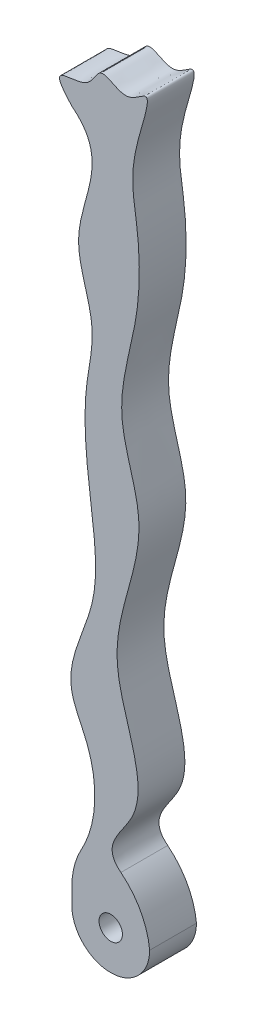
from build123d import *

# Parameters (mm, degrees)
SKETCH1_R           = 1.5
BOSS_EXTRUDE1_DEPTH = 6
SKETCH3_W           = 6
SKETCH3_H           = 19.728320027
SKETCH3_H_2         = 60.271679973
BOSS_EXTRUDE2_DEPTH = 10
SKETCH4_W           = 9.051057065
SKETCH4_H           = 6
CUT_EXTRUDE1_DEPTH  = 162
SKETCH5_W           = 2.776805371
SKETCH5_H           = 7.673994378
CUT_EXTRUDE2_DEPTH  = 162
SKETCH6_W           = 9.98
SKETCH6_H           = 6
BOSS_EXTRUDE3_DEPTH = 10
BOSS_EXTRUDE4_DEPTH = 6
CUT_EXTRUDE4_DEPTH  = 6
CUT_EXTRUDE5_DEPTH  = 6
FILLET1_START       = -1
FILLET1_DEPTH       = 8


with BuildPart() as part:
    # Sketch1 → Boss-Extrude1 (new body)
    with BuildSketch(Plane.XY):
        with BuildLine():
            Line((0, 0), (0, -9.98))
            Line((0, -9.98), (9.98, -9.98))
            Line((9.98, -9.98), (9.98, 0))
            add(Edge.make_bspline(
                [(0, 54.250736404), (-1.3001908, 57.732186027), (3.264697289, 54.364229546), (2.426320397, 59.671317952), (6.24965715, 57.931332096), (7.559999273, 60.308317398), (10.808963849, 60.427698471), (10.337139395, 56.901907174), (8.667893464, 54.394927102), (7.624843251, 50.040394793), (9.267984866, 44.554889548), (7.046090887, 37.973638675), (9.84685356, 30.217018819), (6.270285073, 21.673277978), (10.793667439, 11.106885954), (4.474903421, 3.416500301), (9.98, 0)],
                knots=[0, 0, 0, 0, 0.053422047, 0.084053188, 0.123826292, 0.153487584, 0.181182143, 0.220513, 0.254555574, 0.310198036, 0.38825613, 0.476667751, 0.573339812, 0.700293064, 0.81918735, 1, 1, 1, 1], degree=3))
            add(Edge.make_bspline(
                [(0, 54.250736404), (5.084395927, 51.698919308), (-1.040481835, 45.991903649), (5.447322124, 39.887247803), (0.909066537, 34.169036482), (6.005419265, 27.503354662), (0.487031558, 20.054851145), (5.671743487, 12.84454135), (0.403542473, 6.211235786), (5.177057559, 1.35031129), (0, 0)],
                knots=[0, 0, 0, 0, 0.175024795, 0.269809775, 0.365352016, 0.476782251, 0.63395402, 0.755982767, 0.862891176, 1, 1, 1, 1], degree=3))
        make_face()
        with Locations((4.99, -4.99)):
            Circle(SKETCH1_R, mode=Mode.SUBTRACT)
    extrude(amount=BOSS_EXTRUDE1_DEPTH)

    # Sketch3 → Boss-Extrude2 (add)
    with BuildSketch(Plane.ZY):
        with Locations((3, 70.135839987)):
            Rectangle(SKETCH3_W, SKETCH3_H)
        with Locations((3, 30.135839987)):
            Rectangle(SKETCH3_W, SKETCH3_H_2)
    extrude(amount=-BOSS_EXTRUDE2_DEPTH)

    # Sketch4 → Cut-Extrude1 (cut)
    with BuildSketch(Plane.XZ):
        with Locations((14.505528533, 3)):
            Rectangle(SKETCH4_W, SKETCH4_H)
    extrude(amount=-CUT_EXTRUDE1_DEPTH, mode=Mode.SUBTRACT)

    # Sketch5 → Cut-Extrude2 (cut)
    with BuildSketch(Plane.XZ.offset(9.98)):
        with Locations((-1.388402686, 2.163002811)):
            Rectangle(SKETCH5_W, SKETCH5_H)
    extrude(amount=-CUT_EXTRUDE2_DEPTH, mode=Mode.SUBTRACT)

    # Sketch6 → Boss-Extrude3 (add)
    with BuildSketch(Plane(origin=(0, 80, 0), x_dir=(1, 0, 0), z_dir=(0, 1, 0))):
        with Locations((4.99, -3)):
            Rectangle(SKETCH6_W, SKETCH6_H)
    extrude(amount=BOSS_EXTRUDE3_DEPTH)

    # Sketch7 → Boss-Extrude4 (add)
    with BuildSketch(Plane.XY.offset(6)):
        with BuildLine():
            Line((0, 0), (9.98, 0))
            add(Edge.make_bspline(
                [(0, 83.724231828), (-3.860120501, 87.893159061), (1.875984915, 85.269985621), (3.67621996, 90.493946858), (6.74031748, 87.256477942), (10.910791453, 91.330502674), (6.94132405, 80.93059981), (8.63400219, 74.989003981), (8.904822247, 63.614217887), (4.761347691, 53.094578021), (11.070596211, 39.679531964), (2.06869458, 25.535490062), (12.628458408, 9.599332358), (1.827356394, 2.776036691), (9.98, 0)],
                knots=[0, 0, 0, 0, 0.06130885, 0.083016766, 0.115331592, 0.138604375, 0.192961713, 0.27875924, 0.366903135, 0.489663243, 0.583584237, 0.749388452, 0.899317268, 1, 1, 1, 1], degree=3))
            add(Edge.make_bspline(
                [(0, 83.724231828), (5.303604513, 79.627551199), (-1.724082843, 71.171061089), (3.506871724, 61.210633208), (1.012601117, 51.32037438), (2.484565744, 41.12836032), (3.801376789, 29.33837591), (-1.788318883, 20.592225029), (3.990043149, 11.280963243), (3.127348918, 3.88723838), (0, 0)],
                knots=[0, 0, 0, 0, 0.178407716, 0.282250633, 0.360012872, 0.523096627, 0.638532862, 0.770288181, 0.82976307, 1, 1, 1, 1], degree=3))
        make_face()
    extrude(amount=-BOSS_EXTRUDE4_DEPTH)

    # Sketch8 → Cut-Extrude4 (cut)
    with BuildSketch(Plane.XY):
        with BuildLine():
            Line((-20.353011205, 0), (0, 0))
            add(Edge.make_bspline(
                [(0, 83.724231828), (5.303604513, 79.627551199), (-1.724082843, 71.171061089), (3.506871724, 61.210633208), (1.012601117, 51.32037438), (2.484565744, 41.12836032), (3.801376789, 29.33837591), (-1.788318883, 20.592225029), (3.990043149, 11.280963243), (3.127348918, 3.88723838), (0, 0)],
                knots=[0, 0, 0, 0, 0.178407716, 0.282250633, 0.360012872, 0.523096627, 0.638532862, 0.770288181, 0.82976307, 1, 1, 1, 1], degree=3))
            add(Edge.make_bspline(
                [(0, 83.724231828), (-3.860120501, 87.893159061), (1.875984915, 85.269985621), (3.67621996, 90.493946858), (6.74031748, 87.256477942), (10.910791453, 91.330502674), (6.94132405, 80.93059981), (8.63400219, 74.989003981), (8.904822247, 63.614217887), (4.761347691, 53.094578021), (11.070596211, 39.679531964), (2.06869458, 25.535490062), (12.628458408, 9.599332358), (1.827356394, 2.776036691), (9.98, 0)],
                knots=[0, 0, 0, 0, 0.06130885, 0.083016766, 0.115331592, 0.138604375, 0.192961713, 0.27875924, 0.366903135, 0.489663243, 0.583584237, 0.749388452, 0.899317268, 1, 1, 1, 1], degree=3))
            Line((9.98, 0), (9.98, 96.522655466))
            Line((9.98, 96.522655466), (-20.353011205, 96.522655466))
            Line((-20.353011205, 96.522655466), (-20.353011205, 0))
        make_face()
    extrude(amount=CUT_EXTRUDE4_DEPTH, mode=Mode.SUBTRACT)

    # Sketch9 → Cut-Extrude5 (cut)
    with BuildSketch(Plane(origin=(0, 0, 0), x_dir=(-1, 0, 0), z_dir=(0, 0, -1))):
        with BuildLine():
            ThreePointArc((-4.99, -9.98), (-8.518462838, -8.518462838), (-9.98, -4.99))
            Line((-9.98, -4.99), (-9.98, -9.98))
            Line((-9.98, -9.98), (-4.99, -9.98))
        make_face()
        with BuildLine():
            Line((0, -9.98), (0, -4.99))
            ThreePointArc((0, -4.99), (-1.461537162, -8.518462838), (-4.99, -9.98))
            Line((-4.99, -9.98), (0, -9.98))
        make_face()
    extrude(amount=-CUT_EXTRUDE5_DEPTH, mode=Mode.SUBTRACT)

    # Fillet1: read off the stored shape, not the designer's step
    # Fillet1 outline → Fillet1 (cut)
    with BuildSketch(Plane.XY.offset(FILLET1_START)):
        with BuildLine():
            add(Edge.make_bspline(
                [(9.98, 0), (8.218626493, 0.599760976), (7.040344633, 1.197898042), (6.291253035, 1.799266729)],
                knots=[0, 0, 0, 0, 0.021752441, 0.021752441, 0.021752441, 0.021752441], degree=3))
            ThreePointArc((6.291253035, 1.799266729), (8.817837972, -1.22470725), (9.98, -4.99))
            Line((9.98, -4.99), (9.98, 0))
        make_face()
        with BuildLine():
            ThreePointArc((0, -2.973337376), (0.315821695, -0.480008166), (1.24333811, 1.855831552))
            add(Edge.make_bspline(
                [(1.24333811, 1.855831552), (0.885295295, 1.206597716), (0.470846329, 0.585253507), (0, 0)],
                knots=[0.974369526, 0.974369526, 0.974369526, 0.974369526, 1, 1, 1, 1], degree=3))
            Line((0, 0), (0, -2.973337376))
        make_face()
    extrude(amount=FILLET1_DEPTH, mode=Mode.SUBTRACT)


solid = part.part
